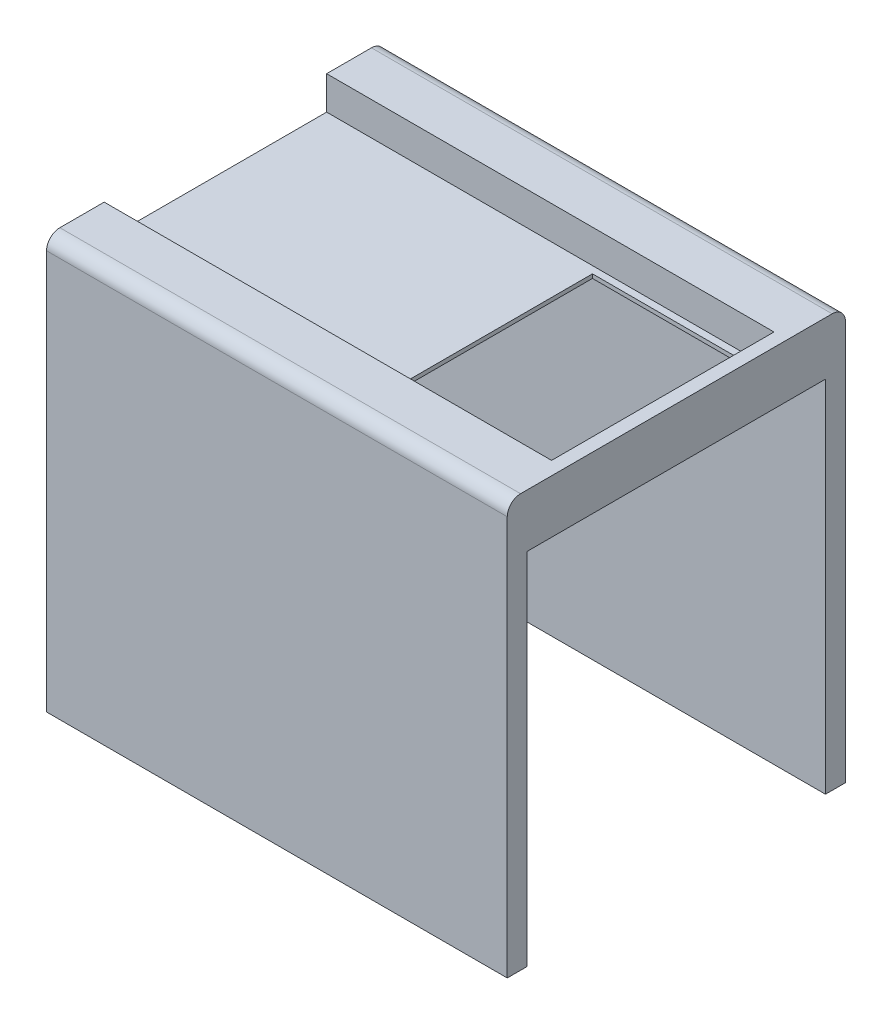
from build123d import *

# Parameters (mm, degrees)
SKETCH1_W                                  = 170
SKETCH1_H                                  = 87
BOSS_EXTRUDE1_DEPTH                        = 2
SKETCH1_9_W                                = 170
SKETCH1_9_H                                = 87
BOSS_EXTRUDE5_DEPTH                        = 2
SKETCH1_10_W                               = 63
SKETCH1_10_H                               = 78
CUT_EXTRUDE3_DEPTH                         = 9
SKETCH1_12_W                               = 170
SKETCH1_12_H                               = 87
BOSS_EXTRUDE6_DEPTH                        = 14
SKETCH1_13_W                               = 63
SKETCH1_13_H                               = 78
CUT_EXTRUDE4_DEPTH                         = 10
SKETCH8_W                                  = 83.526029731
SKETCH8_H                                  = 12.5
CUT_EXTRUDE5_DEPTH                         = 168
BOSS_EXTRUDE10_DEPTH                       = 20
SKETCH25_W                                 = 170
SKETCH25_H                                 = 7.5
BOSS_EXTRUDE18_DEPTH                       = 150
SKETCH28_W                                 = 170
SKETCH28_H                                 = 7.5
BOSS_EXTRUDE19_DEPTH                       = 150
SKETCH29_W                                 = 2
SKETCH29_H                                 = 12.5
BOSS_EXTRUDE20_DEPTH                       = 15
MIRROR16_AT_THE_SECOND_PLANE_COPY_1_SKET_W = 2
MIRROR16_AT_THE_SECOND_PLANE_COPY_1_SKET_H = 12.5
MIRROR16_AT_THE_SECOND_PLANE_COPY_1_DEPTH  = 15
SKETCH31_W                                 = 2
SKETCH31_H                                 = 87
BOSS_EXTRUDE21_DEPTH                       = 6
BOSS_EXTRUDE22_DEPTH                       = 3
FILLET14_R                                 = 5


with BuildPart() as part:
    # Sketch1 → Boss-Extrude1 (new body)
    with BuildSketch(Plane(origin=(0, 0, 0), x_dir=(1, 0, 0), z_dir=(0, 1, 0))):
        with Locations((82.5, 41)):
            Rectangle(SKETCH1_W, SKETCH1_H)
    extrude(amount=BOSS_EXTRUDE1_DEPTH)


with BuildPart() as body_2:
    # Sketch1<9> → Boss-Extrude5 (new body)
    with BuildSketch(Plane(origin=(0, 0, 0), x_dir=(1, 0, 0), z_dir=(0, 1, 0))):
        with Locations((82.5, 41)):
            Rectangle(SKETCH1_9_W, SKETCH1_9_H)
    extrude(amount=BOSS_EXTRUDE5_DEPTH)

    # Sketch1<10> → Cut-Extrude3 (cut)
    with BuildSketch(Plane(origin=(0, 0, 0), x_dir=(1, 0, 0), z_dir=(0, 1, 0))):
        with Locations((131.5, 41)):
            Rectangle(SKETCH1_10_W, SKETCH1_10_H)
    extrude(amount=CUT_EXTRUDE3_DEPTH, mode=Mode.SUBTRACT)

    # Sketch1<12> → Boss-Extrude6 (add)
    with BuildSketch(Plane(origin=(0, 0, 0), x_dir=(1, 0, 0), z_dir=(0, 1, 0))):
        with Locations((82.5, 41)):
            Rectangle(SKETCH1_12_W, SKETCH1_12_H)
    extrude(amount=BOSS_EXTRUDE6_DEPTH)

    # Sketch1<13> → Cut-Extrude4 (cut)
    with BuildSketch(Plane(origin=(0, 0, 0), x_dir=(1, 0, 0), z_dir=(0, 1, 0))):
        with Locations((131.5, 41)):
            Rectangle(SKETCH1_13_W, SKETCH1_13_H)
    extrude(amount=CUT_EXTRUDE4_DEPTH, mode=Mode.SUBTRACT)

    # Sketch8 → Cut-Extrude5 (cut)
    with BuildSketch(Plane.ZY.offset(2.5)):
        with Locations((-40.910699185, 7.75)):
            Rectangle(SKETCH8_W, SKETCH8_H)
    extrude(amount=-CUT_EXTRUDE5_DEPTH, mode=Mode.SUBTRACT)

    # Sketch11 → Boss-Extrude10 (add)
    with BuildSketch(Plane.XY.offset(2.5)):
        Polygon((-2.5, 14), (90, 14), (167.5, 14), (167.5, 9), (90, 9), (-2.5, 9), align=None)
    boss_extrude10 = extrude(amount=BOSS_EXTRUDE10_DEPTH)

    # Mirror10: Boss-Extrude10 across plane
    add(boss_extrude10.mirror(Plane.XY.offset(-41)))

    # Sketch25 → Boss-Extrude18 (add)
    with BuildSketch(Plane.XZ.offset(-9)):
        with Locations((82.5, -100.75)):
            Rectangle(SKETCH25_W, SKETCH25_H)
    extrude(amount=BOSS_EXTRUDE18_DEPTH)

    # Sketch28 → Boss-Extrude19 (add)
    with BuildSketch(Plane.XZ.offset(-9)):
        with Locations((82.5, 18.75)):
            Rectangle(SKETCH28_W, SKETCH28_H)
    extrude(amount=BOSS_EXTRUDE19_DEPTH)

    # Sketch29 → Boss-Extrude20 (add)
    with BuildSketch(Plane.XZ.offset(-9)):
        with Locations((-1.5, -90.75)):
            Rectangle(SKETCH29_W, SKETCH29_H)
    boss_extrude20 = extrude(amount=BOSS_EXTRUDE20_DEPTH)

    # Mirror16: Boss-Extrude20 across plane
    add(boss_extrude20.mirror(Plane.XY.offset(-41)))

    # Mirror16 at the second plane: Boss-Extrude20 across plane
    add(boss_extrude20.mirror(Plane.ZY.offset(-82.5)))

    # Mirror16 at the second plane copy 1 sket → Mirror16 at the second plane copy 1 (add)
    with BuildSketch(Plane(origin=(165, 9, -82), x_dir=(-1, 0, 0), z_dir=(0, -1, 0))):
        with Locations((-1.5, -90.75)):
            Rectangle(MIRROR16_AT_THE_SECOND_PLANE_COPY_1_SKET_W, MIRROR16_AT_THE_SECOND_PLANE_COPY_1_SKET_H)
    extrude(amount=MIRROR16_AT_THE_SECOND_PLANE_COPY_1_DEPTH)

    # Sketch31 → Boss-Extrude21 (add)
    with BuildSketch(Plane.XZ):
        with Locations((-1.5, -41)):
            Rectangle(SKETCH31_W, SKETCH31_H)
    boss_extrude21 = extrude(amount=BOSS_EXTRUDE21_DEPTH)

    # Mirror17: Boss-Extrude21 across plane
    add(boss_extrude21.mirror(Plane.ZY.offset(-82.5)))

    # Sketch34 → Boss-Extrude22 (add)
    with BuildSketch(Plane(origin=(167.5, 0, 0), x_dir=(0, 0, -1), z_dir=(1, 0, 0))):
        Polygon((-22.5, 14), (104.5, 14), (104.5, -141), (97, -141), (97, -6), (-15, -6), (-15, -141), (-22.5, -141), align=None)
    extrude(amount=BOSS_EXTRUDE22_DEPTH)

    # Fillet14
    fillet14_edges = [body_2.edges().sort_by_distance(p)[0] for p in [
        (84, 14, -104.5),
        (84, 14, 22.5),
        (82.5, 9, -97),
        (82.5, 9, 15),
    ]]
    fillet(fillet14_edges, radius=FILLET14_R)


solid = body_2.part
